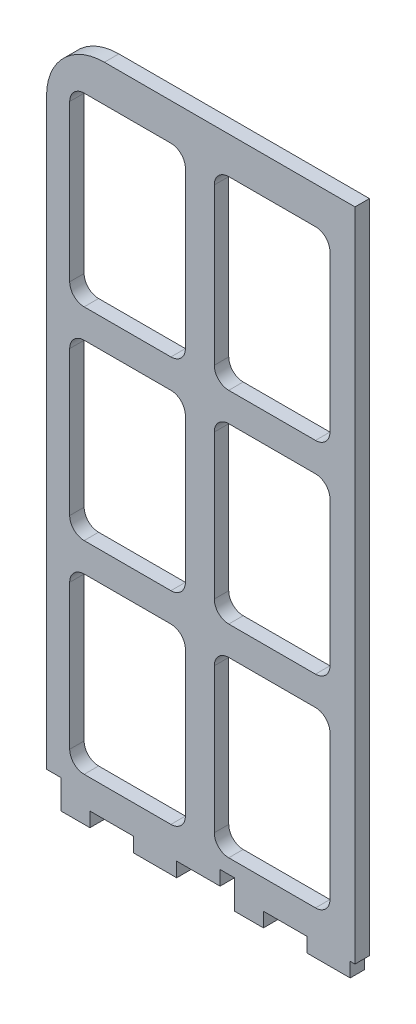
from build123d import *

# Parameters (mm, degrees)
BOSS_EXTRUDE1_DEPTH = 6.35
CUT_EXTRUDE1_DEPTH  = 319.315227787
SKETCH3_W           = 6.35
SKETCH3_H           = 12.7
CUT_EXTRUDE2_DEPTH  = 319.315227787


with BuildPart() as part:
    # Sketch1 → Boss-Extrude1 (new body)
    with BuildSketch(Plane.XY):
        with BuildLine():
            Line((133.35, 0), (135.457692, 0))
            Line((135.457692, 0), (135.457692, 287.9852))
            Line((135.457692, 287.9852), (25.4, 287.9852))
            ThreePointArc((25.4, 287.9852), (7.439487758, 280.545712242), (0, 262.5852))
            Line((0, 262.5852), (0, 0))
            Line((0, 0), (0, -6.35))
            Line((0, -6.35), (19.05, -6.35))
            Line((19.05, -6.35), (19.05, 0))
            Line((19.05, 0), (38.1, 0))
            Line((38.1, 0), (38.1, -6.35))
            Line((38.1, -6.35), (57.15, -6.35))
            Line((57.15, -6.35), (57.15, 0))
            Line((57.15, 0), (76.2, 0))
            Line((76.2, 0), (76.2, -6.35))
            Line((76.2, -6.35), (95.25, -6.35))
            Line((95.25, -6.35), (95.25, 0))
            Line((95.25, 0), (114.3, 0))
            Line((114.3, 0), (114.3, -6.35))
            Line((114.3, -6.35), (133.35, -6.35))
            Line((133.35, -6.35), (133.35, 0))
        make_face()
    extrude(amount=BOSS_EXTRUDE1_DEPTH)

    # Sketch2 → Cut-Extrude1 (cut, through all)
    with BuildSketch(Plane.XY.offset(6.35)):
        with BuildLine():
            Line((73.66, 19.05), (73.66, 82.55))
            ThreePointArc((73.66, 82.55), (75.519871939, 87.040128061), (80.01, 88.9))
            Line((80.01, 88.9), (118.11, 88.9))
            ThreePointArc((118.11, 88.9), (122.600128061, 87.040128061), (124.46, 82.55))
            Line((124.46, 82.55), (124.46, 19.05))
            ThreePointArc((124.46, 19.05), (122.600128061, 14.559871939), (118.11, 12.7))
            Line((118.11, 12.7), (80.01, 12.7))
            ThreePointArc((80.01, 12.7), (75.519871939, 14.559871939), (73.66, 19.05))
        make_face()
        with BuildLine():
            Line((16.51, 12.7), (54.61, 12.7))
            ThreePointArc((54.61, 12.7), (59.100128061, 14.559871939), (60.96, 19.05))
            Line((60.96, 19.05), (60.96, 82.55))
            ThreePointArc((60.96, 82.55), (59.100128061, 87.040128061), (54.61, 88.9))
            Line((54.61, 88.9), (16.51, 88.9))
            ThreePointArc((16.51, 88.9), (12.019871939, 87.040128061), (10.16, 82.55))
            Line((10.16, 82.55), (10.16, 19.05))
            ThreePointArc((10.16, 19.05), (12.019871939, 14.559871939), (16.51, 12.7))
        make_face()
        with BuildLine():
            Line((73.66, 196.85), (73.66, 265.43))
            ThreePointArc((73.66, 265.43), (75.519871939, 269.920128061), (80.01, 271.78))
            Line((80.01, 271.78), (118.11, 271.78))
            ThreePointArc((118.11, 271.78), (122.600128061, 269.920128061), (124.46, 265.43))
            Line((124.46, 265.43), (124.46, 196.85))
            ThreePointArc((124.46, 196.85), (122.600128061, 192.359871939), (118.11, 190.5))
            Line((118.11, 190.5), (80.01, 190.5))
            ThreePointArc((80.01, 190.5), (75.519871939, 192.359871939), (73.66, 196.85))
        make_face()
        with BuildLine():
            Line((10.16, 196.85), (10.16, 265.43))
            ThreePointArc((10.16, 265.43), (12.019871939, 269.920128061), (16.51, 271.78))
            Line((16.51, 271.78), (54.61, 271.78))
            ThreePointArc((54.61, 271.78), (59.100128061, 269.920128061), (60.96, 265.43))
            Line((60.96, 265.43), (60.96, 196.85))
            ThreePointArc((60.96, 196.85), (59.100128061, 192.359871939), (54.61, 190.5))
            Line((54.61, 190.5), (16.51, 190.5))
            ThreePointArc((16.51, 190.5), (12.019871939, 192.359871939), (10.16, 196.85))
        make_face()
        with BuildLine():
            Line((73.66, 107.95), (73.66, 171.45))
            ThreePointArc((73.66, 171.45), (75.519871939, 175.940128061), (80.01, 177.8))
            Line((80.01, 177.8), (118.11, 177.8))
            ThreePointArc((118.11, 177.8), (122.600128061, 175.940128061), (124.46, 171.45))
            Line((124.46, 171.45), (124.46, 107.95))
            ThreePointArc((124.46, 107.95), (122.600128061, 103.459871939), (118.11, 101.6))
            Line((118.11, 101.6), (80.01, 101.6))
            ThreePointArc((80.01, 101.6), (75.519871939, 103.459871939), (73.66, 107.95))
        make_face()
        with BuildLine():
            Line((10.16, 107.95), (10.16, 171.45))
            ThreePointArc((10.16, 171.45), (12.019871939, 175.940128061), (16.51, 177.8))
            Line((16.51, 177.8), (54.61, 177.8))
            ThreePointArc((54.61, 177.8), (59.100128061, 175.940128061), (60.96, 171.45))
            Line((60.96, 171.45), (60.96, 107.95))
            ThreePointArc((60.96, 107.95), (59.100128061, 103.459871939), (54.61, 101.6))
            Line((54.61, 101.6), (16.51, 101.6))
            ThreePointArc((16.51, 101.6), (12.019871939, 103.459871939), (10.16, 107.95))
        make_face()
    extrude(amount=-CUT_EXTRUDE1_DEPTH, mode=Mode.SUBTRACT)

    # Sketch3 → Cut-Extrude2 (cut, through all)
    with BuildSketch(Plane.XY.offset(6.35)):
        with Locations((3.175, 0)):
            Rectangle(SKETCH3_W, SKETCH3_H)
        with Locations((79.375, 0)):
            Rectangle(SKETCH3_W, SKETCH3_H)
    extrude(amount=-CUT_EXTRUDE2_DEPTH, mode=Mode.SUBTRACT)


solid = part.part
